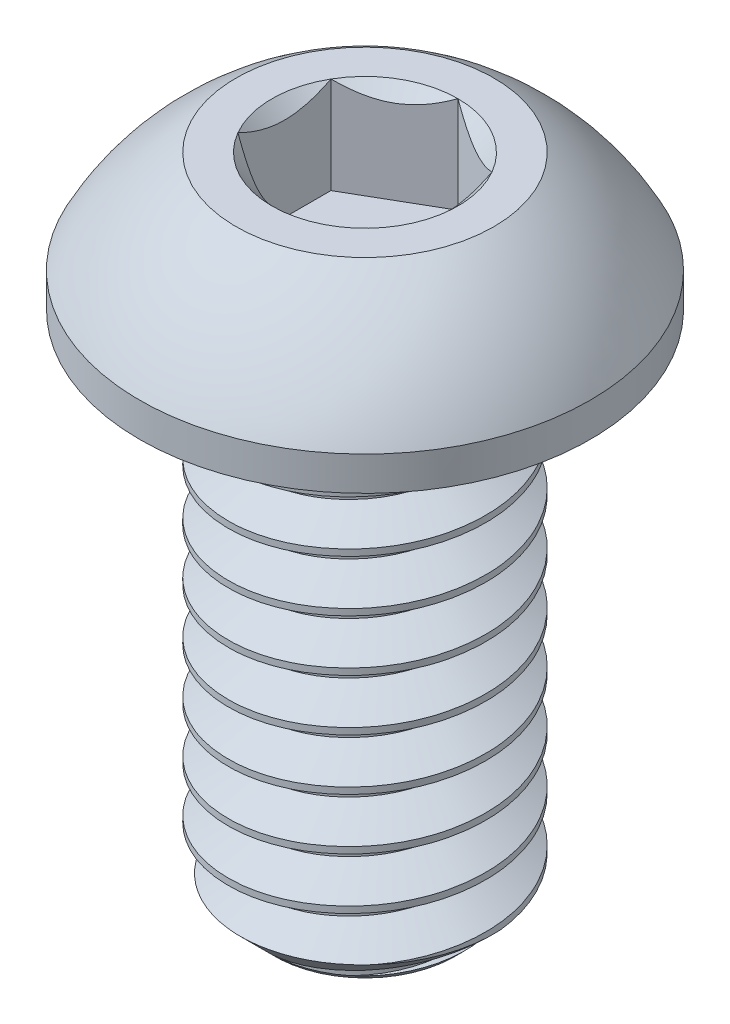
from build123d import *

# Parameters (mm, degrees)
SKETCH1_R           = 3.175
BOSS_EXTRUDE1_DEPTH = 12.7
CUT_SWEEP1_PITCH    = 1.27
SKETCH4_OUTSIDE_W   = 14
SKETCH4_OUTSIDE_H   = 14
SKETCH4_OUTSIDE_R   = 2.21262927
CUT_EXTRUDE1_DEPTH  = 1.27
CUT_EXTRUDE1_DRAFT  = -45
CUT_EXTRUDE2_DEPTH  = 2.38125


with BuildPart() as part:
    # Sketch1 → Boss-Extrude1 (new body)
    with BuildSketch(Plane(origin=(0, 0, 0), x_dir=(1, 0, 0), z_dir=(0, 1, 0))):
        with Locations(Location((0, 0, 0), (0, 0, 270))):
            Circle(SKETCH1_R)
    extrude(amount=-BOSS_EXTRUDE1_DEPTH)

    # Cut-Sweep1: the profile of Sketch3 screwed along a right-hand helix of 11 turns, 8 arcs to a turn; built about Z, then put on its axis
    cut_sweep1_z = Axis((0, 0, 0), (0, 0, 1))
    cut_sweep1_corners = [(2.350110803, 0, -0.47625), (3.243740766, 0, 0.0396875), (3.243740766, 0, -1.1509375), (2.350110803, 0, -0.635)]
    with BuildLine(mode=Mode.PRIVATE) as cut_sweep1_profile:
        Line(cut_sweep1_corners[0], cut_sweep1_corners[1])
        Line(cut_sweep1_corners[1], cut_sweep1_corners[2])
        Line(cut_sweep1_corners[2], cut_sweep1_corners[3])
        Line(cut_sweep1_corners[3], cut_sweep1_corners[0])
    cut_sweep1_cap = Face(cut_sweep1_profile.wire())
    cut_sweep1_turn_angles = [0, 22.5, 45, 67.5, 90, 112.5, 135, 157.5, 180, 202.5, 225, 247.5, 270, 292.5, 315, 337.5, 360]
    cut_sweep1_turn_weights = [1, 0.9238795325112867, 1, 0.9238795325112867, 1, 0.9238795325112867, 1, 0.9238795325112867, 1, 0.9238795325112867, 1, 0.9238795325112867, 1, 0.9238795325112867, 1, 0.9238795325112867, 1]
    cut_sweep1_turn_rails = [Edge.make_bspline([Vector(p[0], p[1], 0).rotate(cut_sweep1_z, cut_sweep1_turn_angles[k]) / cut_sweep1_turn_weights[k] + Vector(0, 0, p[2] + CUT_SWEEP1_PITCH * cut_sweep1_turn_angles[k] / 360) for k in range(17)], [0, 0, 0, 1, 1, 2, 2, 3, 3, 4, 4, 5, 5, 6, 6, 7, 7, 8, 8, 8], 2, cut_sweep1_turn_weights) for p in cut_sweep1_corners]
    cut_sweep1_turn_sides = [Face.make_surface_from_curves(cut_sweep1_turn_rails[p[0]], cut_sweep1_turn_rails[p[1]]) for p in [(0, 1), (1, 2), (2, 3), (3, 0)]]
    cut_sweep1 = Plane(origin=(0, -12.7, 0), x_dir=(0, 0, -1), z_dir=(0, 1, 0)) * Solid(Shell([*[p.moved(Location((0, 0, CUT_SWEEP1_PITCH * i))) for i in range(11) for p in cut_sweep1_turn_sides], cut_sweep1_cap, cut_sweep1_cap.rotate(cut_sweep1_z, 3960).moved(Location((0, 0, CUT_SWEEP1_PITCH * 3960 / 360)))]))
    add(cut_sweep1, mode=Mode.SUBTRACT)


with BuildPart() as cut_extrude1_tool:
    # Sketch4 outside → Cut-Extrude1 (with draft: the straight prism first)
    with BuildSketch(Plane.XZ.offset(12.7)):
        Rectangle(SKETCH4_OUTSIDE_W, SKETCH4_OUTSIDE_H)
        Circle(SKETCH4_OUTSIDE_R, mode=Mode.SUBTRACT)
    extrude(amount=-CUT_EXTRUDE1_DEPTH)
    # Cut-Extrude1: the draft: its side faces are tilted about the plane it starts from
    cut_extrude1_sides = [cut_extrude1_tool.faces().sort_by_distance(p)[0] for p in [
        (0, -12.065, -7),
        (7, -12.065, 0),
        (0, -12.065, 7),
        (-7, -12.065, 0),
        (-2.21262927, -12.065, 0),
    ]]
    draft(cut_extrude1_sides, Plane.XZ.offset(12.7), CUT_EXTRUDE1_DRAFT)


with BuildPart() as part_1:
    add(part.part)

    # Cut-Extrude1: cut by cut_extrude1_tool
    add(cut_extrude1_tool.part, mode=Mode.SUBTRACT)

    # Sketch5 → Revolve1 (revolve)
    with BuildSketch(Plane.XY, mode=Mode.PRIVATE) as revolve1_sk:
        with BuildLine():
            Line((0, 0), (0, 3.3528))
            Line((0, 3.3528), (-3.175, 3.3528))
            ThreePointArc((-3.175, 3.3528), (-4.540019085, 2.263204136), (-5.5499, 0.8382))
            Line((-5.5499, 0.8382), (-5.5499, 0))
            Line((-5.5499, 0), (0, 0))
        make_face()
    revolve(revolve1_sk.sketch.rotate(Axis((0, 0, 0), (0, 1, 0)), 270), axis=Axis((0, 0, 0), (0, 1, 0)))

    # Sketch6 → Cut-Extrude2 (cut)
    with BuildSketch(Plane(origin=(0, 3.3528, 0), x_dir=(1, 0, 0), z_dir=(0, 1, 0))):
        Polygon((0, 2.291358881), (-1.984375, 1.14567944), (-1.984375, -1.14567944), (0, -2.291358881), (1.984375, -1.14567944), (1.984375, 1.14567944), align=None)
    extrude(amount=-CUT_EXTRUDE2_DEPTH, mode=Mode.SUBTRACT)

    # Cut-Extrude3 cone 1 section (through the dimple's axis) → Cut-Extrude3 (revolve, cut)
    with BuildSketch(Plane(origin=(0, 3.3528, 0), x_dir=(0, 0, 1), z_dir=(1, 0, 0))):
        Polygon((0, 0), (2.291358881, 0), (0, 2.291358881), align=None)
    revolve(axis=Axis((0, 3.3528, 0), (0, -1, 0)), mode=Mode.SUBTRACT)


solid = part_1.part
